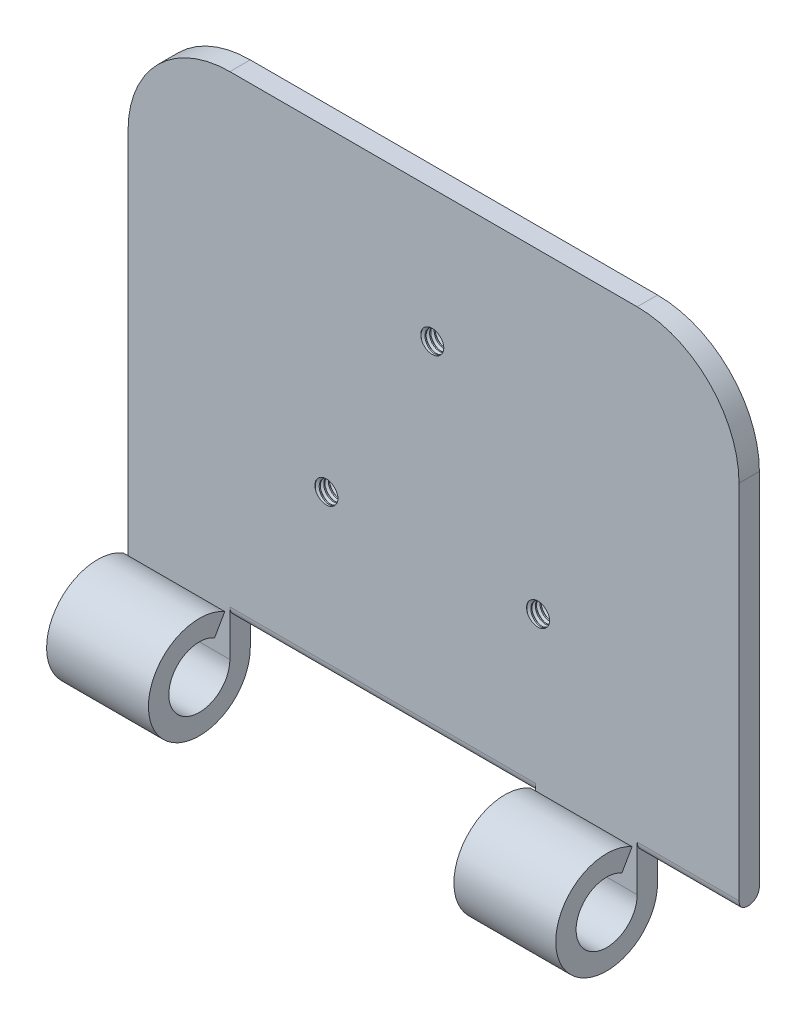
from build123d import *

# Parameters (mm, degrees)
SKETCH1_W           = 60
SKETCH1_H           = 50
BOSS_EXTRUDE1_DEPTH = 2
BOSS_EXTRUDE2_DEPTH = 10
BOSS_EXTRUDE3_DEPTH = 10
SKETCH8_R           = 5
CUT_EXTRUDE2_DEPTH  = 30
CUT_EXTRUDE3_START  = -10
SKETCH5_R           = 5
CUT_EXTRUDE3_DEPTH  = 10
FILLET1_START       = -20
FILLET1_DEPTH       = 30
FILLET1_START_2     = 20
FILLET1_2_DEPTH     = 11
FILLET3_R           = 1.1
SKETCH9_R           = 1.25
CUT_EXTRUDE4_DEPTH  = 10
THREAD1_PITCH       = 0.45
THREAD1_TO          = 2
THREAD2_PITCH       = 0.45
THREAD2_TO          = 2
THREAD3_PITCH       = 0.45
THREAD3_TO          = 2
FILLET4_R           = 10


with BuildPart() as part:
    # Sketch1 → Boss-Extrude1 (new body)
    with BuildSketch(Plane.XY):
        Rectangle(SKETCH1_W, SKETCH1_H)
    extrude(amount=BOSS_EXTRUDE1_DEPTH)

    # Sketch2 → Boss-Extrude2 (add)
    with BuildSketch(Plane.ZY.offset(30)):
        with BuildLine():
            Line((2, -25), (0, -25))
            ThreePointArc((0, -25), (9.330127019, -27.5), (2.5, -20.669872981))
            Line((2.5, -20.669872981), (3.5, -22.401923789))
            ThreePointArc((3.5, -22.401923789), (7.598076211, -26.5), (2, -25))
        make_face()
    extrude(amount=-BOSS_EXTRUDE2_DEPTH)

    # Sketch7 → Boss-Extrude3 (add)
    with BuildSketch(Plane(origin=(10, 0, -10), x_dir=(0, 0, 1), z_dir=(-1, 0, 0))):
        with BuildLine():
            ThreePointArc((13.5, -22.401923789), (17.598076211, -26.5), (12, -25))
            Line((12, -25), (10, -25))
            ThreePointArc((10, -25), (15, -30), (20, -25))
            ThreePointArc((20, -25), (17.5, -20.669872981), (12.5, -20.669872981))
            Line((12.5, -20.669872981), (13.5, -22.401923789))
        make_face()
    extrude(amount=-BOSS_EXTRUDE3_DEPTH)

    # Sketch8 → Cut-Extrude2 (cut)
    with BuildSketch(Plane(origin=(-20, 0, 0), x_dir=(0, 0, -1), z_dir=(1, 0, 0))):
        with Locations((-5, -25)):
            Circle(SKETCH8_R)
    extrude(amount=CUT_EXTRUDE2_DEPTH, mode=Mode.SUBTRACT)

    # Sketch5 → Cut-Extrude3 (cut)
    with BuildSketch(Plane(origin=(30, 0, 0), x_dir=(0, 0, -1), z_dir=(1, 0, 0)).offset(CUT_EXTRUDE3_START)):
        with Locations((-5, -25)):
            Circle(SKETCH5_R)
    extrude(amount=CUT_EXTRUDE3_DEPTH, mode=Mode.SUBTRACT)

    # Fillet1: read off the stored shape, not the designer's step
    # Fillet1 outline → Fillet1 (cut)
    with BuildSketch(Plane.YZ.offset(FILLET1_START)):
        with BuildLine():
            ThreePointArc((-20.30958424, 0), (-21.305477447, 0.632884681), (-21.155396918, 1.803278689))
            ThreePointArc((-21.155396918, 1.803278689), (-22.87674855, 0.473212698), (-25, 0))
            Line((-25, 0), (-20.30958424, 0))
        make_face()
    extrude(amount=FILLET1_DEPTH, mode=Mode.SUBTRACT)

    # Fillet1 2 outline → Fillet1 2 (cut)
    with BuildSketch(Plane.YZ.offset(FILLET1_START_2)):
        with BuildLine():
            ThreePointArc((-20.30958424, 0), (-21.305477447, 0.632884681), (-21.155396918, 1.803278689))
            ThreePointArc((-21.155396918, 1.803278689), (-22.87674855, 0.473212698), (-25, 0))
            Line((-25, 0), (-20.30958424, 0))
        make_face()
    extrude(amount=FILLET1_2_DEPTH, mode=Mode.SUBTRACT)

    # Fillet3
    # the kernel refuses this fillet: 1.1 mm, written as the material it takes off along each edge
    with BuildSketch(Plane(origin=(31.180917646, -21, 2), x_dir=(0, 1, 0), z_dir=(-1, 0, 0))) as fillet3_piece_1:
        with BuildLine():
            CenterArc((0.472367058, 1.1), FILLET3_R, 235.201328768, 34.798671232)
            Line((-0.155396918, 0.196721311), (-0.167952198, 0.178655737))
            ThreePointArc((-0.167952198, 0.178655737), (-0.093728896, 0.085697663), (-0.0176, -0.0132))
            Line((-0.0176, -0.0132), (0, -0.022))
            Line((0, -0.022), (0.472367058, -0.022))
            Line((0.472367058, -0.022), (0.472367058, 0))
        make_face()
    extrude(amount=11.180917646, mode=Mode.SUBTRACT)
    with BuildSketch(Plane(origin=(10, -21, 2), x_dir=(0, 1, 0), z_dir=(-1, 0, 0))) as fillet3_piece_2:
        with BuildLine():
            CenterArc((0.472367058, 1.1), FILLET3_R, 235.201328768, 34.798671232)
            Line((-0.155396918, 0.196721311), (-0.167952198, 0.178655737))
            ThreePointArc((-0.167952198, 0.178655737), (-0.093728896, 0.085697663), (-0.0176, -0.0132))
            Line((-0.0176, -0.0132), (0, -0.022))
            Line((0, -0.022), (0.472367058, -0.022))
            Line((0.472367058, -0.022), (0.472367058, 0))
        make_face()
    extrude(amount=30, mode=Mode.SUBTRACT)

    # Sketch9 → Cut-Extrude4 (cut)
    with BuildSketch(Plane.XY.offset(2)):
        with Locations((0, 12)):
            Circle(SKETCH9_R)
        with Locations((10.392304845, -6)):
            Circle(SKETCH9_R)
        with Locations((-10.392304845, -6)):
            Circle(SKETCH9_R)
    extrude(amount=-CUT_EXTRUDE4_DEPTH, mode=Mode.SUBTRACT)

    # Thread1: arcs per turn and ends read off the stored shape
    # Thread1: the profile of Thread Profile1 profile screwed along a right-hand helix through 25 turns, 6 arcs to a turn; built about Z, then put on its axis
    thread1_z = Axis((0, 0, 0), (0, 0, 1))
    thread1_corners = [(1.2503, 0, -0.000173205), (1.2503, 0, 0.393923204), (1.006430357, 0, 0.253124999), (1.006430357, 0, 0.140624999)]
    with BuildLine(mode=Mode.PRIVATE) as thread1_profile:
        Line(thread1_corners[0], thread1_corners[1])
        Line(thread1_corners[1], thread1_corners[2])
        Line(thread1_corners[2], thread1_corners[3])
        Line(thread1_corners[3], thread1_corners[0])
    thread1_cap = Face(thread1_profile.wire())
    thread1_turn_angles = [0, 30, 60, 90, 120, 150, 180, 210, 240, 270, 300, 330, 360]
    thread1_turn_weights = [1, 0.8660254037844387, 1, 0.8660254037844387, 1, 0.8660254037844387, 1, 0.8660254037844387, 1, 0.8660254037844387, 1, 0.8660254037844387, 1]
    thread1_turn_rails = [Edge.make_bspline([Vector(p[0], p[1], 0).rotate(thread1_z, thread1_turn_angles[k]) / thread1_turn_weights[k] + Vector(0, 0, p[2] + THREAD1_PITCH * thread1_turn_angles[k] / 360) for k in range(13)], [0, 0, 0, 1, 1, 2, 2, 3, 3, 4, 4, 5, 5, 6, 6, 6], 2, thread1_turn_weights) for p in thread1_corners]
    thread1_turn_sides = [Face.make_surface_from_curves(thread1_turn_rails[p[0]], thread1_turn_rails[p[1]]) for p in [(0, 1), (1, 2), (2, 3), (3, 0)]]
    thread1 = Plane(origin=(10.392304845, -6, 0), x_dir=(1, 0, 0), z_dir=(0, 0, 1)) * split(Solid(Shell([*[p.moved(Location((0, 0, THREAD1_PITCH * i))) for i in range(25) for p in thread1_turn_sides], thread1_cap, thread1_cap.rotate(thread1_z, 9000).moved(Location((0, 0, THREAD1_PITCH * 9000 / 360)))])), bisect_by=Plane.XY.offset(THREAD1_TO), keep=Keep.BOTTOM, mode=Mode.PRIVATE)
    add(thread1)

    # Thread2: arcs per turn and ends read off the stored shape
    # Thread2: the profile of Thread Profile2 profile screwed along a right-hand helix through 25 turns, 6 arcs to a turn; built about Z, then put on its axis
    thread2_z = Axis((0, 0, 0), (0, 0, 1))
    thread2_corners = [(1.2503, 0, -0.000173205), (1.2503, 0, 0.393923204), (1.006430356, 0, 0.253124999), (1.006430356, 0, 0.140624999)]
    with BuildLine(mode=Mode.PRIVATE) as thread2_profile:
        Line(thread2_corners[0], thread2_corners[1])
        Line(thread2_corners[1], thread2_corners[2])
        Line(thread2_corners[2], thread2_corners[3])
        Line(thread2_corners[3], thread2_corners[0])
    thread2_cap = Face(thread2_profile.wire())
    thread2_turn_angles = [0, 30, 60, 90, 120, 150, 180, 210, 240, 270, 300, 330, 360]
    thread2_turn_weights = [1, 0.8660254037844387, 1, 0.8660254037844387, 1, 0.8660254037844387, 1, 0.8660254037844387, 1, 0.8660254037844387, 1, 0.8660254037844387, 1]
    thread2_turn_rails = [Edge.make_bspline([Vector(p[0], p[1], 0).rotate(thread2_z, thread2_turn_angles[k]) / thread2_turn_weights[k] + Vector(0, 0, p[2] + THREAD2_PITCH * thread2_turn_angles[k] / 360) for k in range(13)], [0, 0, 0, 1, 1, 2, 2, 3, 3, 4, 4, 5, 5, 6, 6, 6], 2, thread2_turn_weights) for p in thread2_corners]
    thread2_turn_sides = [Face.make_surface_from_curves(thread2_turn_rails[p[0]], thread2_turn_rails[p[1]]) for p in [(0, 1), (1, 2), (2, 3), (3, 0)]]
    thread2 = Plane(origin=(-10.392304845, -6, 0), x_dir=(1, 0, 0), z_dir=(0, 0, 1)) * split(Solid(Shell([*[p.moved(Location((0, 0, THREAD2_PITCH * i))) for i in range(25) for p in thread2_turn_sides], thread2_cap, thread2_cap.rotate(thread2_z, 9000).moved(Location((0, 0, THREAD2_PITCH * 9000 / 360)))])), bisect_by=Plane.XY.offset(THREAD2_TO), keep=Keep.BOTTOM, mode=Mode.PRIVATE)
    add(thread2)

    # Thread3: arcs per turn and ends read off the stored shape
    # Thread3: the profile of Thread Profile3 profile screwed along a right-hand helix through 25 turns, 6 arcs to a turn; built about Z, then put on its axis
    thread3_z = Axis((0, 0, 0), (0, 0, 1))
    thread3_corners = [(1.2503, 0, -0.000173205), (1.2503, 0, 0.393923204), (1.006430356, 0, 0.253124999), (1.006430356, 0, 0.140624999)]
    with BuildLine(mode=Mode.PRIVATE) as thread3_profile:
        Line(thread3_corners[0], thread3_corners[1])
        Line(thread3_corners[1], thread3_corners[2])
        Line(thread3_corners[2], thread3_corners[3])
        Line(thread3_corners[3], thread3_corners[0])
    thread3_cap = Face(thread3_profile.wire())
    thread3_turn_angles = [0, 30, 60, 90, 120, 150, 180, 210, 240, 270, 300, 330, 360]
    thread3_turn_weights = [1, 0.8660254037844387, 1, 0.8660254037844387, 1, 0.8660254037844387, 1, 0.8660254037844387, 1, 0.8660254037844387, 1, 0.8660254037844387, 1]
    thread3_turn_rails = [Edge.make_bspline([Vector(p[0], p[1], 0).rotate(thread3_z, thread3_turn_angles[k]) / thread3_turn_weights[k] + Vector(0, 0, p[2] + THREAD3_PITCH * thread3_turn_angles[k] / 360) for k in range(13)], [0, 0, 0, 1, 1, 2, 2, 3, 3, 4, 4, 5, 5, 6, 6, 6], 2, thread3_turn_weights) for p in thread3_corners]
    thread3_turn_sides = [Face.make_surface_from_curves(thread3_turn_rails[p[0]], thread3_turn_rails[p[1]]) for p in [(0, 1), (1, 2), (2, 3), (3, 0)]]
    thread3 = Plane(origin=(0, 12, 0), x_dir=(1, 0, 0), z_dir=(0, 0, 1)) * split(Solid(Shell([*[p.moved(Location((0, 0, THREAD3_PITCH * i))) for i in range(25) for p in thread3_turn_sides], thread3_cap, thread3_cap.rotate(thread3_z, 9000).moved(Location((0, 0, THREAD3_PITCH * 9000 / 360)))])), bisect_by=Plane.XY.offset(THREAD3_TO), keep=Keep.BOTTOM, mode=Mode.PRIVATE)
    add(thread3)

    # Fillet4
    fillet4_edges = [part.edges().sort_by_distance(p)[0] for p in [
        (-30, 25, 1),
        (30, 25, 1),
    ]]
    fillet(fillet4_edges, radius=FILLET4_R)


solid = part.part
